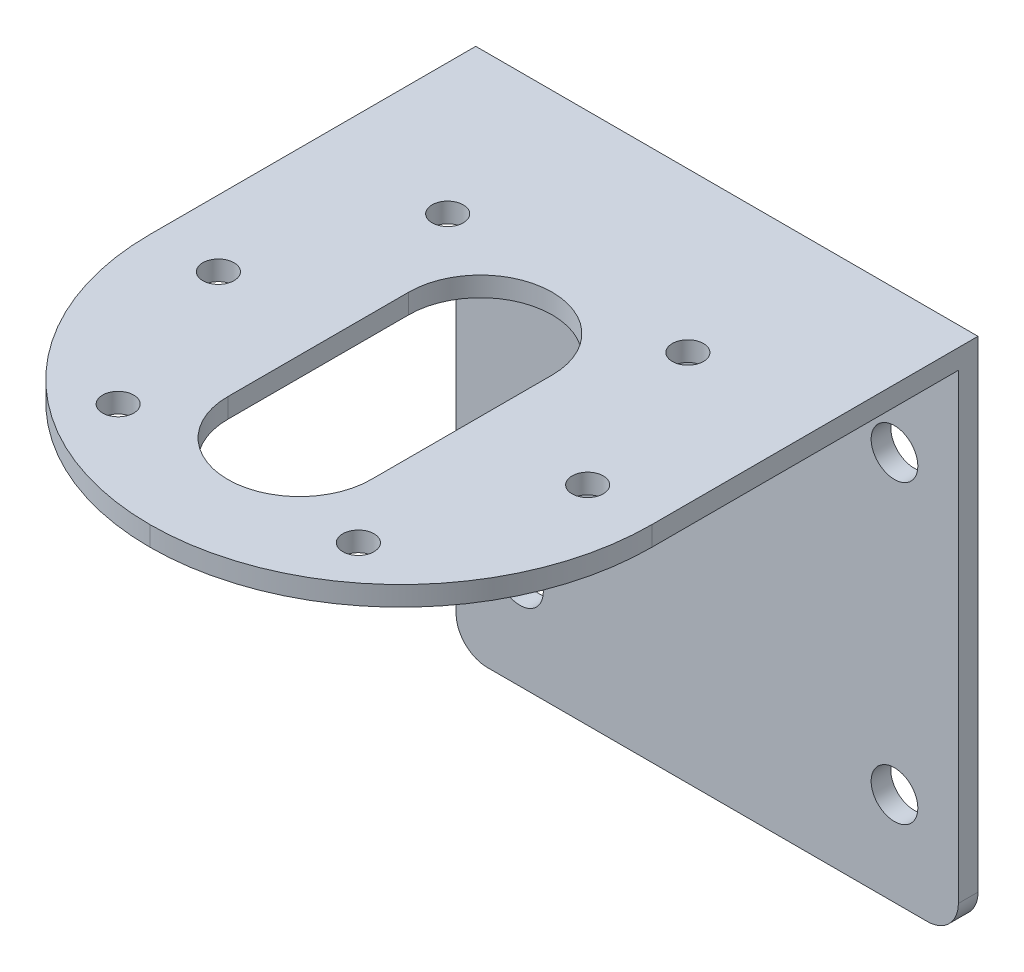
from build123d import *

# Parameters (mm, degrees)
SKETCH1_W           = 40.894
SKETCH1_H           = 40.132
BOSS_EXTRUDE1_DEPTH = 1.600000102
SKETCH2_R           = 1.90000001
CUT_EXTRUDE1_DEPTH  = 58.318903168
SKETCH2_3_R         = 1.90000001
CUT_EXTRUDE2_DEPTH  = 58.318903168
FILLET1_R           = 2.54
SKETCH5_W           = 40.894
SKETCH5_H           = 46.99
BOSS_EXTRUDE2_DEPTH = 1.600000102
FILLET2_R           = 20.447
SKETCH6_R           = 1.27
CUT_EXTRUDE3_DEPTH  = 75.97959168
CUT_EXTRUDE4_DEPTH  = 75.97959168


with BuildPart() as part:
    # Sketch1 → Boss-Extrude1 (new body)
    with BuildSketch(Plane.XY):
        with Locations((20.447, 20.066)):
            Rectangle(SKETCH1_W, SKETCH1_H)
    extrude(amount=BOSS_EXTRUDE1_DEPTH)

    # Sketch2 → Cut-Extrude1 (cut, through all)
    with BuildSketch(Plane.XY.offset(1.600000102)):
        with Locations((5.200000014, 7.612000016)):
            Circle(SKETCH2_R)
    cut_extrude1 = extrude(amount=-CUT_EXTRUDE1_DEPTH, mode=Mode.SUBTRACT)

    # Sketch2<3> → Cut-Extrude2 (cut, through all)
    with BuildSketch(Plane.XY.offset(1.600000102)):
        with Locations((5.200000014, 31.732000036)):
            Circle(SKETCH2_3_R)
        with Locations((5.200000014, 7.612000016)):
            Circle(SKETCH2_3_R)
    cut_extrude2 = extrude(amount=-CUT_EXTRUDE2_DEPTH, mode=Mode.SUBTRACT)

    # Mirror2: Cut-Extrude1, Cut-Extrude2 across plane
    add(cut_extrude1.mirror(Plane.ZY.offset(-20.447)), mode=Mode.SUBTRACT)
    add(cut_extrude2.mirror(Plane.ZY.offset(-20.447)), mode=Mode.SUBTRACT)

    # Fillet1
    fillet1_edges = [part.edges().sort_by_distance(p)[0] for p in [
        (40.894, 0, 0.800000051),
        (0, 0, 0.800000051),
    ]]
    fillet(fillet1_edges, radius=FILLET1_R)

    # Sketch5 → Boss-Extrude2 (add)
    with BuildSketch(Plane(origin=(0, 40.132, 0), x_dir=(1, 0, 0), z_dir=(0, 1, 0))):
        with Locations((20.447, -23.495)):
            Rectangle(SKETCH5_W, SKETCH5_H)
    extrude(amount=BOSS_EXTRUDE2_DEPTH)

    # Fillet2
    fillet2_edges = [part.edges().sort_by_distance(p)[0] for p in [
        (0, 40.932000051, 46.99),
        (40.894, 40.932000051, 46.99),
    ]]
    fillet(fillet2_edges, radius=FILLET2_R - 0.0001)  # a hair under: the kernel refuses the full size

    # Sketch6 → Cut-Extrude3 (cut, through all)
    with BuildSketch(Plane(origin=(0, 41.732000102, 0), x_dir=(1, 0, 0), z_dir=(0, 1, 0))):
        with Locations(Location((30.226, -39.783999934, 0), (0, 0, 270))):
            Circle(SKETCH6_R)
        with Locations(Location((30.226, -12.954, 0), (0, 0, 270))):
            Circle(SKETCH6_R)
        with Locations(Location((35.480000033, -26.368999967, 0), (0, 0, 270))):
            Circle(SKETCH6_R)
    cut_extrude3 = extrude(amount=-CUT_EXTRUDE3_DEPTH, mode=Mode.SUBTRACT)

    # Mirror3: Cut-Extrude3 across plane
    add(cut_extrude3.mirror(Plane.ZY.offset(-20.447)), mode=Mode.SUBTRACT)

    # Sketch7 → Cut-Extrude4 (cut, through all)
    with BuildSketch(Plane(origin=(0, 41.732000102, 0), x_dir=(1, 0, 0), z_dir=(0, 1, 0))):
        with BuildLine():
            Line((14.605, -34.798), (14.605, -20.066))
            ThreePointArc((14.605, -20.066), (20.447, -14.224), (26.289, -20.066))
            Line((26.289, -20.066), (26.289, -34.798))
            ThreePointArc((26.289, -34.798), (20.447, -40.64), (14.605, -34.798))
        make_face()
    extrude(amount=-CUT_EXTRUDE4_DEPTH, mode=Mode.SUBTRACT)


solid = part.part
